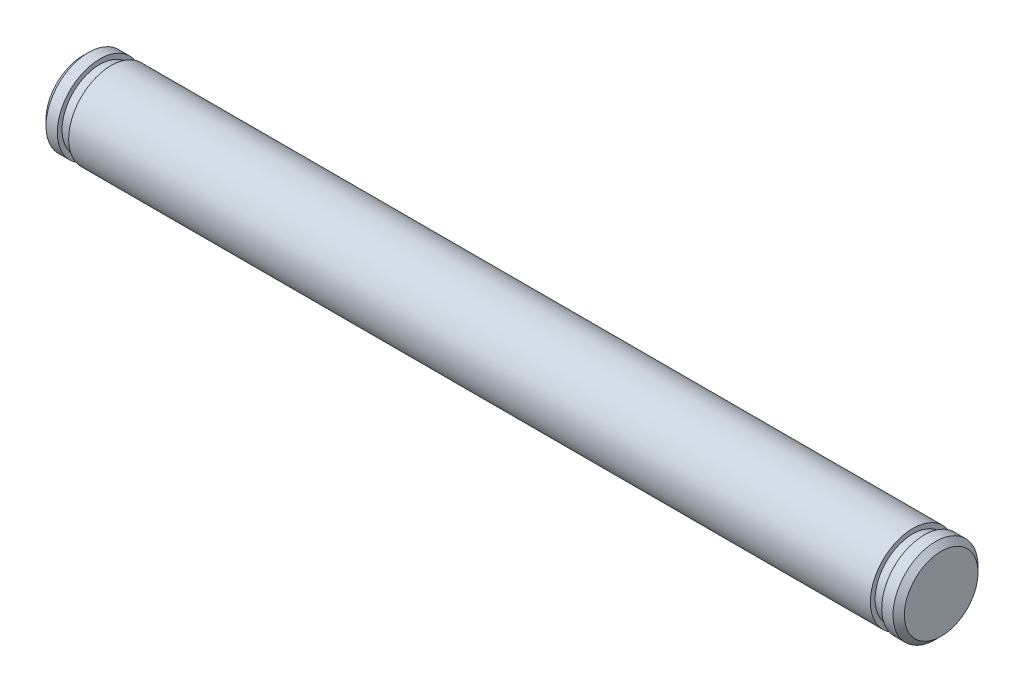
from build123d import *

# Parameters (mm, degrees)
CHAMFER1_SIZE = 0.4


with BuildPart() as part:
    # Sketch1 → Revolve1 (revolve)
    with BuildSketch(Plane.XY):
        Polygon((-2, 0), (58.602, 0), (58.602, 3), (57.402, 3), (57.402, 2.667), (56.602, 2.667), (56.602, 3), (0, 3), (0, 2.667), (-0.8, 2.667), (-0.8, 3), (-2, 3), align=None)
    revolve(axis=Axis((-2, 0, 0), (-1, 0, 0)))

    # Chamfer1
    chamfer1_edges = [part.edges().sort_by_distance(p)[0] for p in [
        (-2, -3, 0),
        (58.602, -3, 0),
    ]]
    chamfer(chamfer1_edges, length=CHAMFER1_SIZE)


solid = part.part
